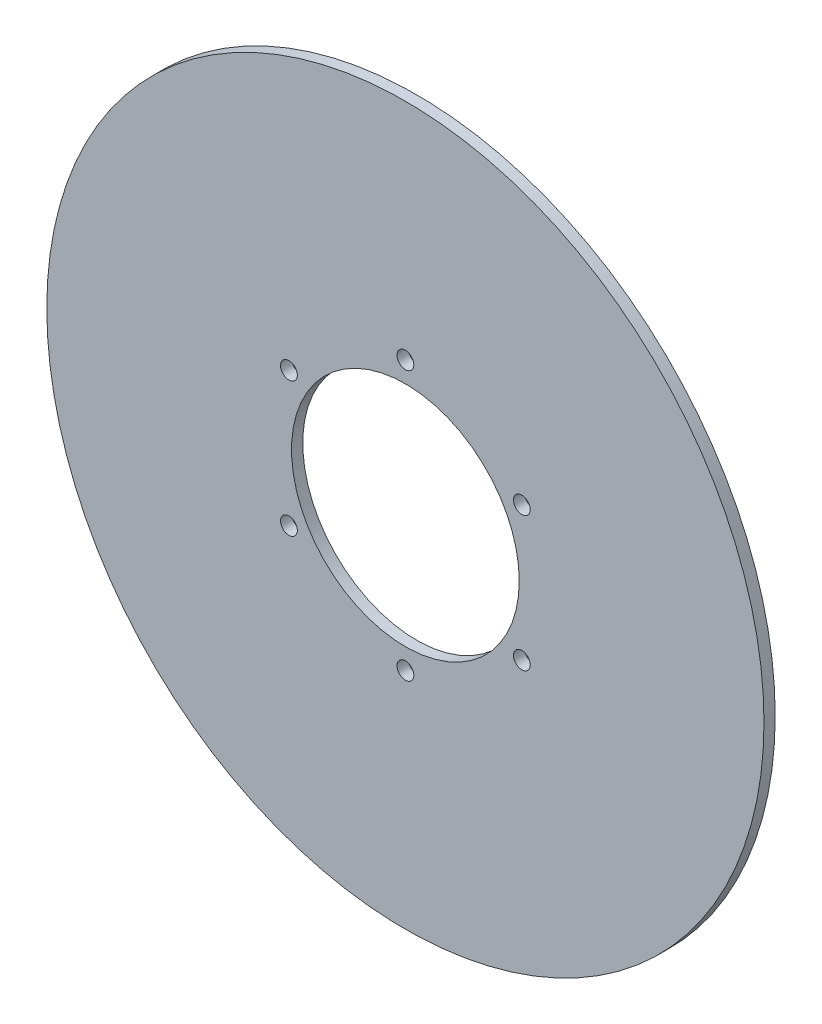
from build123d import *

# Parameters (mm, degrees)
SKETCH1_R           = 50.8
SKETCH1_R_2         = 16.129
BOSS_EXTRUDE1_DEPTH = 1.5875
CIRPATTERN1_COUNT   = 6


with BuildPart() as part:
    # Sketch1 → Boss-Extrude1 (new body)
    with BuildSketch(Plane.XY):
        Circle(SKETCH1_R)
        Circle(SKETCH1_R_2, mode=Mode.SUBTRACT)
    extrude(amount=BOSS_EXTRUDE1_DEPTH)

    # Sketch2 → 3/32 (0.09375) Diameter Hole1 (revolve, cut)
    with BuildSketch(Plane(origin=(0, 19.05, 1.5875), x_dir=(0, -1, 0), z_dir=(1, 0, 0))):
        Polygon((0, 0), (0, 26.115399675), (1.190625, 25.4), (1.190625, 0), align=None)
    f_3_32_0_09375_diameter_hole1 = revolve(axis=Axis((0, 19.05, 7.9375), (0, 0, -1)), mode=Mode.SUBTRACT)

    # CirPattern1: 3/32 (0.09375) Diameter Hole1 ×6 about axis
    cirpattern1_axis = Axis((0, 0, 1.5875), (0, 0, 1))
    for i in range(1, CIRPATTERN1_COUNT):
        add(f_3_32_0_09375_diameter_hole1.rotate(cirpattern1_axis, i * 360 / CIRPATTERN1_COUNT), mode=Mode.SUBTRACT)


solid = part.part
